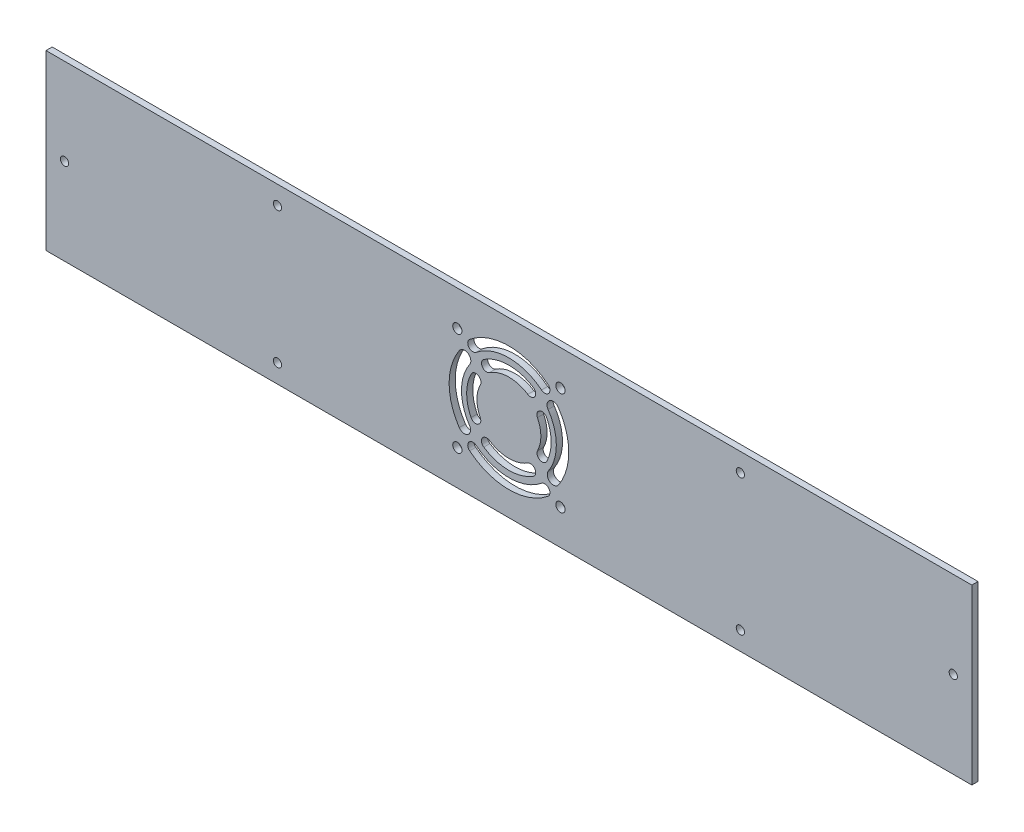
from build123d import *

# Parameters (mm, degrees)
SCHIZZO1_W                   = 449
SCHIZZO1_H                   = 84
SCHIZZO1_R                   = 2
SCHIZZO1_R_2                 = 2.25
ESTRUSIONE_ESTRUSIONE1_DEPTH = 3
TAGLIO_ESTRUSIONE1_DEPTH     = 10


with BuildPart() as part:
    # Schizzo1 → Estrusione-Estrusione1 (new body)
    with BuildSketch(Plane.XY):
        with Locations((224.5, 42)):
            Rectangle(SCHIZZO1_W, SCHIZZO1_H)
        with Locations((9, 42)):
            Circle(SCHIZZO1_R, mode=Mode.SUBTRACT)
        with Locations((440, 42)):
            Circle(SCHIZZO1_R, mode=Mode.SUBTRACT)
        with Locations((199.5, 67)):
            Circle(SCHIZZO1_R_2, mode=Mode.SUBTRACT)
        with Locations((199.5, 17)):
            Circle(SCHIZZO1_R_2, mode=Mode.SUBTRACT)
        with Locations((249.5, 17)):
            Circle(SCHIZZO1_R_2, mode=Mode.SUBTRACT)
        with Locations((249.5, 67)):
            Circle(SCHIZZO1_R_2, mode=Mode.SUBTRACT)
        with Locations((112.25, 75)):
            Circle(SCHIZZO1_R, mode=Mode.SUBTRACT)
        with Locations((336.75, 75)):
            Circle(SCHIZZO1_R, mode=Mode.SUBTRACT)
        with Locations((336.75, 9)):
            Circle(SCHIZZO1_R, mode=Mode.SUBTRACT)
        with Locations((112.25, 9)):
            Circle(SCHIZZO1_R, mode=Mode.SUBTRACT)
    extrude(amount=ESTRUSIONE_ESTRUSIONE1_DEPTH)

    # Schizzo2 → Taglio-Estrusione1 (cut)
    with BuildSketch(Plane.XY.offset(3)):
        with BuildLine():
            ThreePointArc((206.216314928, 51.271715839), (204.000026607, 42.094579482), (206.131542389, 32.897383925))
            ThreePointArc((206.131542389, 32.897383925), (209.48164202, 31.767413809), (210.611612136, 35.11751344))
            ThreePointArc((210.611612136, 35.11751344), (208.999973393, 42.071511531), (210.675708639, 49.010342864))
            ThreePointArc((210.675708639, 49.010342864), (209.576698271, 52.370726207), (206.216314928, 51.271715839))
        make_face()
        with BuildLine():
            ThreePointArc((200.542911639, 58.342252474), (195.500022477, 42.112260167), (200.417108385, 25.843712365))
            ThreePointArc((200.417108385, 25.843712365), (204.579754139, 25.023724358), (205.399742146, 29.186370111))
            ThreePointArc((205.399742146, 29.186370111), (201.499977523, 42.089034081), (205.499517315, 54.961119502))
            ThreePointArc((205.499517315, 54.961119502), (204.711780963, 59.129988826), (200.542911639, 58.342252474))
        make_face()
        with BuildLine():
            ThreePointArc((242.783685072, 51.271715839), (244.999973393, 42.094579482), (242.868457611, 32.897383925))
            ThreePointArc((242.868457611, 32.897383925), (239.51835798, 31.767413809), (238.388387864, 35.11751344))
            ThreePointArc((238.388387864, 35.11751344), (240.000026607, 42.071511531), (238.324291361, 49.010342864))
            ThreePointArc((238.324291361, 49.010342864), (239.423301729, 52.370726207), (242.783685072, 51.271715839))
        make_face()
        with BuildLine():
            ThreePointArc((248.457088361, 58.342252474), (253.499977523, 42.112260167), (248.582891615, 25.843712365))
            ThreePointArc((248.582891615, 25.843712365), (244.420245861, 25.023724358), (243.600257854, 29.186370111))
            ThreePointArc((243.600257854, 29.186370111), (247.500022477, 42.089034081), (243.500482685, 54.961119502))
            ThreePointArc((243.500482685, 54.961119502), (244.288219037, 59.129988826), (248.457088361, 58.342252474))
        make_face()
        with BuildLine():
            ThreePointArc((236.350645303, 60.643350741), (224.301773332, 64.090111524), (212.316696028, 60.427680952))
            ThreePointArc((212.316696028, 60.427680952), (211.610030788, 56.963489237), (215.074222503, 56.256823997))
            ThreePointArc((215.074222503, 56.256823997), (224.346639263, 59.090312823), (233.668411629, 56.423679839))
            ThreePointArc((233.668411629, 56.423679839), (237.119363917, 57.192398453), (236.350645303, 60.643350741))
        make_face()
        with BuildLine():
            ThreePointArc((243.470985685, 65.474351119), (224.452639388, 72.181802717), (205.455437064, 65.414697967))
            ThreePointArc((205.455437064, 65.414697967), (205.093453248, 61.897743643), (208.610407572, 61.535759826))
            ThreePointArc((208.610407572, 61.535759826), (224.460485266, 67.181808873), (240.328204171, 61.585530686))
            ThreePointArc((240.328204171, 61.585530686), (243.844005144, 61.958550145), (243.470985685, 65.474351119))
        make_face()
        with BuildLine():
            ThreePointArc((243.470985685, 18.525648881), (224.452639388, 11.818197283), (205.455437064, 18.585302033))
            ThreePointArc((205.455437064, 18.585302033), (205.093453248, 22.102256357), (208.610407572, 22.464240174))
            ThreePointArc((208.610407572, 22.464240174), (224.460485266, 16.818191127), (240.328204171, 22.414469314))
            ThreePointArc((240.328204171, 22.414469314), (243.844005144, 22.041449855), (243.470985685, 18.525648881))
        make_face()
        with BuildLine():
            ThreePointArc((236.350645303, 23.356649259), (224.301773332, 19.909888476), (212.316696028, 23.572319048))
            ThreePointArc((212.316696028, 23.572319048), (211.610030788, 27.036510763), (215.074222503, 27.743176003))
            ThreePointArc((215.074222503, 27.743176003), (224.346639263, 24.909687177), (233.668411629, 27.576320161))
            ThreePointArc((233.668411629, 27.576320161), (237.119363917, 26.807601547), (236.350645303, 23.356649259))
        make_face()
    extrude(amount=-TAGLIO_ESTRUSIONE1_DEPTH, mode=Mode.SUBTRACT)


solid = part.part
